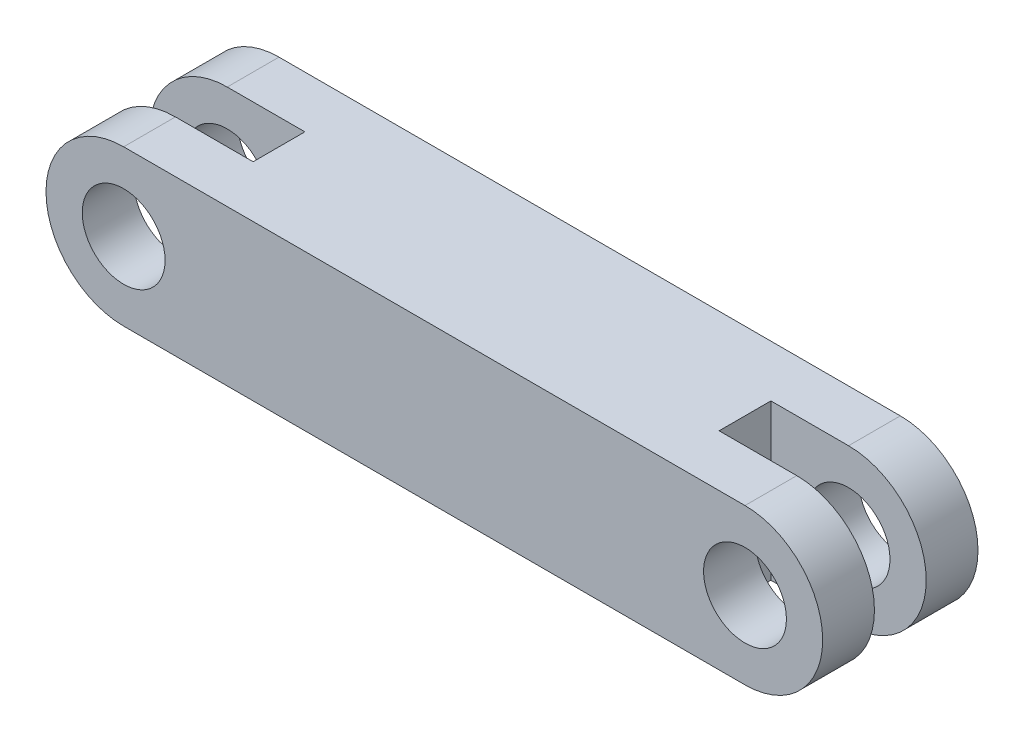
from build123d import *

# Parameters (mm, degrees)
SKETCH1_R           = 4
BOSS_EXTRUDE1_DEPTH = 5
SKETCH2_W           = 45
SKETCH2_H           = 15
BOSS_EXTRUDE2_DEPTH = 5
SKETCH5_R           = 4
BOSS_EXTRUDE3_DEPTH = 5


with BuildPart() as part:
    # Sketch1 → Boss-Extrude1 (new body)
    with BuildSketch(Plane.XY):
        with BuildLine():
            Line((-47.217391304, 7.923913043), (12.782608696, 7.923913043))
            ThreePointArc((12.782608696, 7.923913043), (20.282608696, 0.423913043), (12.782608696, -7.076086957))
            Line((12.782608696, -7.076086957), (-47.217391304, -7.076086957))
            ThreePointArc((-47.217391304, -7.076086957), (-54.717391304, 0.423913043), (-47.217391304, 7.923913043))
        make_face()
        with Locations((-47.217391304, 0.423913043)):
            Circle(SKETCH1_R, mode=Mode.SUBTRACT)
        with Locations((12.782608696, 0.423913043)):
            Circle(SKETCH1_R, mode=Mode.SUBTRACT)
    extrude(amount=BOSS_EXTRUDE1_DEPTH)

    # Sketch2 → Boss-Extrude2 (add)
    with BuildSketch(Plane.XY.offset(5)):
        with Locations((-17.217391304, 0.423913043)):
            Rectangle(SKETCH2_W, SKETCH2_H)
    extrude(amount=BOSS_EXTRUDE2_DEPTH)

    # Sketch5 → Boss-Extrude3 (add)
    with BuildSketch(Plane.XY.offset(10)):
        with BuildLine():
            Line((-47.217391304, 7.923913043), (12.782608696, 7.923913043))
            ThreePointArc((12.782608696, 7.923913043), (20.282608696, 0.423913043), (12.782608696, -7.076086957))
            Line((12.782608696, -7.076086957), (-47.217391304, -7.076086957))
            ThreePointArc((-47.217391304, -7.076086957), (-54.717391304, 0.423913043), (-47.217391304, 7.923913043))
        make_face()
        with Locations((-47.217391304, 0.423913043)):
            Circle(SKETCH5_R, mode=Mode.SUBTRACT)
        with Locations((12.782608696, 0.423913043)):
            Circle(SKETCH5_R, mode=Mode.SUBTRACT)
    extrude(amount=BOSS_EXTRUDE3_DEPTH)


solid = part.part
